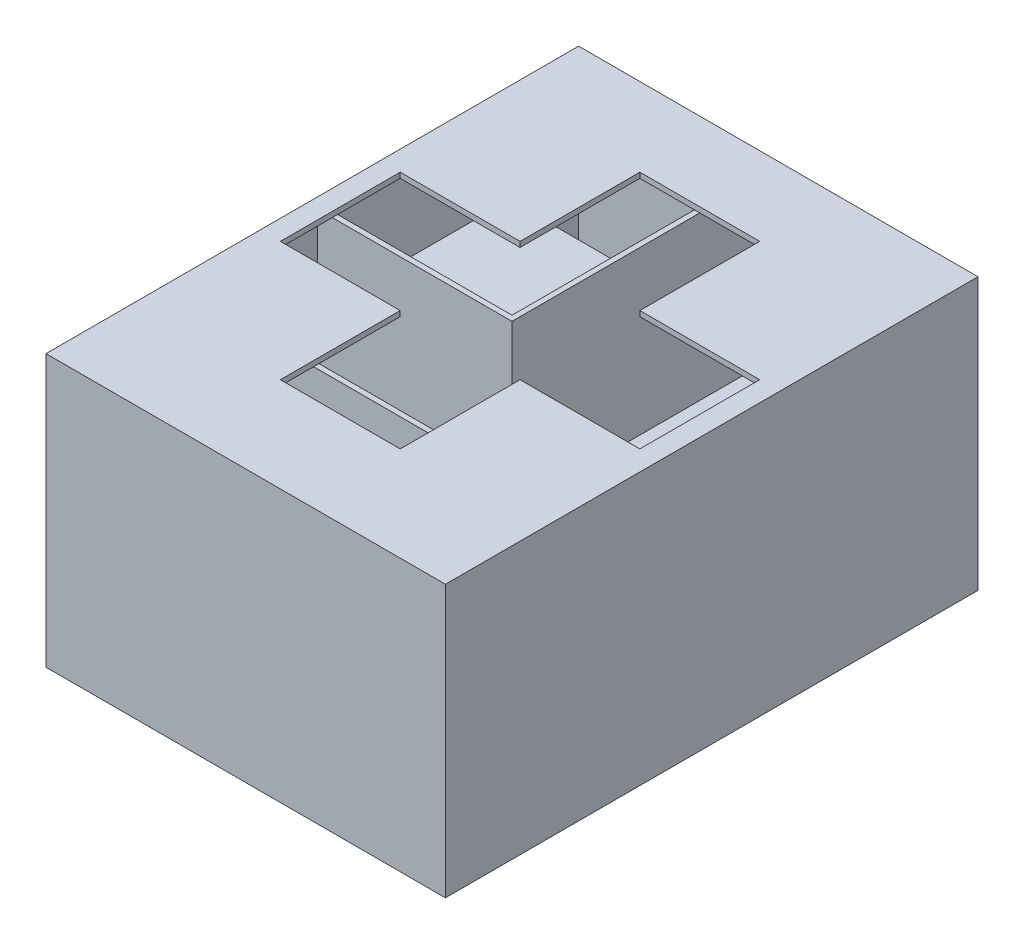
from build123d import *

# Parameters (mm, degrees)
CASING_SKETCH_W     = 150
CASING_SKETCH_H     = 200
CASING_DEPTH        = 100
SHELL1_T            = -2
SKETCH3_W           = 146
SKETCH3_H           = 2
COMPARTMENTS_DEPTH  = 100
SKETCH4_W           = 51
SKETCH4_H           = 60
SKETCH4_W_2         = 30
SKETCH4_H_2         = 100
SKETCH4_W_3         = 35
SKETCH4_H_3         = 40
SKETCH4_W_4         = 70
SKETCH4_H_4         = 30
MEDICINES_DEPTH     = 75
SKETCH6_R           = 17.5
SKETCH6_R_2         = 5
BANDAGE_DEPTH       = 75
SKETCH7_R           = 7.5
VIALS_DEPTH         = 25
SKETCH9_W           = 150
SKETCH9_H           = 200
BOSS_EXTRUDE1_DEPTH = 2
CUT_EXTRUDE1_DEPTH  = 2


with BuildPart() as part:
    # Casing Sketch → Casing (new body)
    with BuildSketch(Plane(origin=(0, 0, 0), x_dir=(1, 0, 0), z_dir=(0, 1, 0))):
        Rectangle(CASING_SKETCH_W, CASING_SKETCH_H)
    extrude(amount=CASING_DEPTH)

    # Shell1
    shell1_openings = [part.faces().sort_by_distance(p)[0] for p in [
        (0, 100, 0),
    ]]
    offset(amount=SHELL1_T, openings=shell1_openings, kind=Kind.INTERSECTION)

    # Sketch3 → Compartments (add)
    with BuildSketch(Plane(origin=(0, 2, 0), x_dir=(1, 0, 0), z_dir=(0, 1, 0))):
        Polygon((-73, 0), (0, 0), (0, 98), (-2, 98), (-2, 2), (-73, 2), align=None)
        with Locations((0, -51)):
            Rectangle(SKETCH3_W, SKETCH3_H)
    extrude(amount=COMPARTMENTS_DEPTH)

    # Sketch4 → Medicines (add)
    with BuildSketch(Plane(origin=(0, 2, 0), x_dir=(1, 0, 0), z_dir=(0, 1, 0))):
        with Locations((-37.5, 32)):
            Rectangle(SKETCH4_W, SKETCH4_H)
        with Locations((53, 0)):
            Rectangle(SKETCH4_W_2, SKETCH4_H_2)
        with Locations((15.5, -30)):
            Rectangle(SKETCH4_W_3, SKETCH4_H_3)
        with Locations((-28, -83)):
            Rectangle(SKETCH4_W_4, SKETCH4_H_4)
    extrude(amount=MEDICINES_DEPTH)

    # Sketch6 → Bandage (add)
    with BuildSketch(Plane(origin=(0, 2, 0), x_dir=(1, 0, 0), z_dir=(0, 1, 0))):
        with Locations((43.231606139, -78.51417502)):
            Circle(SKETCH6_R)
        with Locations((43.231606139, -78.51417502)):
            Circle(SKETCH6_R_2, mode=Mode.SUBTRACT)
    extrude(amount=BANDAGE_DEPTH)

    # Sketch7 → Vials (add)
    with BuildSketch(Plane(origin=(0, 0, 50), x_dir=(-1, 0, 0), z_dir=(0, 0, -1))):
        with Locations((61.244974069, 52)):
            Circle(SKETCH7_R)
        with Locations((37.16355204, 52)):
            Circle(SKETCH7_R)
        with Locations((14.684505224, 52)):
            Circle(SKETCH7_R)
    extrude(amount=VIALS_DEPTH)

    # Sketch9 → Boss-Extrude1 (add)
    with BuildSketch(Plane(origin=(0, 100, 0), x_dir=(1, 0, 0), z_dir=(0, 1, 0))):
        Rectangle(SKETCH9_W, SKETCH9_H)
    extrude(amount=BOSS_EXTRUDE1_DEPTH)

    # Sketch10 → Cut-Extrude1 (cut)
    with BuildSketch(Plane(origin=(0, 102, 0), x_dir=(1, 0, 0), z_dir=(0, 1, 0))):
        Polygon((-22.5, 70.520593301), (22.5, 70.520593301), (22.5, 25.520593301), (67.5, 25.520593301), (67.5, -19.479406699), (22.5, -19.479406699), (22.5, -64.479406699), (-22.5, -64.479406699), (-22.5, -19.479406699), (-67.5, -19.479406699), (-67.5, 25.520593301), (-22.5, 25.520593301), align=None)
    extrude(amount=-CUT_EXTRUDE1_DEPTH, mode=Mode.SUBTRACT)


solid = part.part
